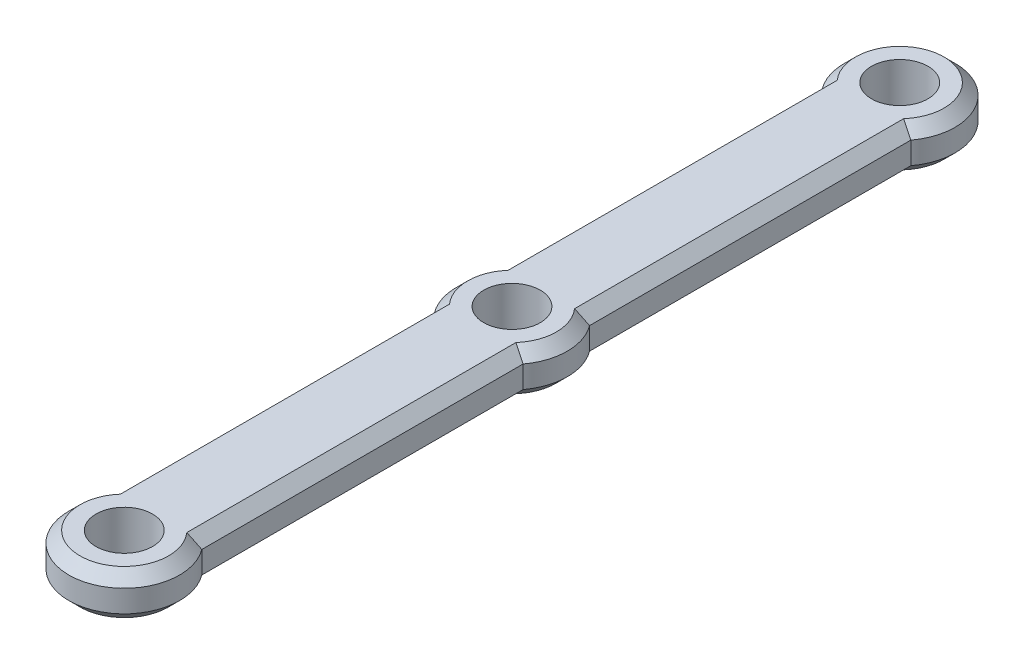
from build123d import *

# Parameters (mm, degrees)
EXTRUDE_1_DEPTH     = 4
SKETCH_2_R          = 2.55
CUT_EXTRUDE_1_DEPTH = 41.509258201
CHAMFER_1_SIZE      = 1


with BuildPart() as part:
    # 草图1 → 凸台-拉伸1 (new body)
    with BuildSketch(Plane(origin=(0, 0, 0), x_dir=(1, 0, 0), z_dir=(0, 1, 0))):
        with BuildLine():
            Line((-4, 32), (-4, 3))
            ThreePointArc((-4, 3), (-5, 0), (-4, -3))
            Line((-4, -3), (-4, -32))
            ThreePointArc((-4, -32), (0, -40), (4, -32))
            Line((4, -32), (4, -3))
            ThreePointArc((4, -3), (5, 0), (4, 3))
            Line((4, 3), (4, 32))
            ThreePointArc((4, 32), (0, 40), (-4, 32))
        make_face()
    extrude(amount=EXTRUDE_1_DEPTH)

    # 草图2 → 切除-拉伸1 (cut, through all)
    with BuildSketch(Plane(origin=(0, 4, 0), x_dir=(1, 0, 0), z_dir=(0, 1, 0))):
        with Locations((0, 35)):
            Circle(SKETCH_2_R)
        with Locations((0, -35)):
            Circle(SKETCH_2_R)
        Circle(SKETCH_2_R)
    extrude(amount=-CUT_EXTRUDE_1_DEPTH, mode=Mode.SUBTRACT)

    # 倒角1
    chamfer_1_edges = [part.edges().sort_by_distance(p)[0] for p in [
        (0, 0, -40),
        (-4, 0, -17.5),
        (0, 0, 40),
        (4, 0, -17.5),
        (0, 4, -40),
        (-4, 4, -17.5),
        (0, 4, 40),
        (4, 4, -17.5),
        (5, 0, 0),
        (4, 0, 17.5),
        (-4, 0, 17.5),
        (-5, 0, 0),
        (5, 4, 0),
        (4, 4, 17.5),
        (-4, 4, 17.5),
        (-5, 4, 0),
    ]]
    chamfer(chamfer_1_edges, length=CHAMFER_1_SIZE)


solid = part.part
